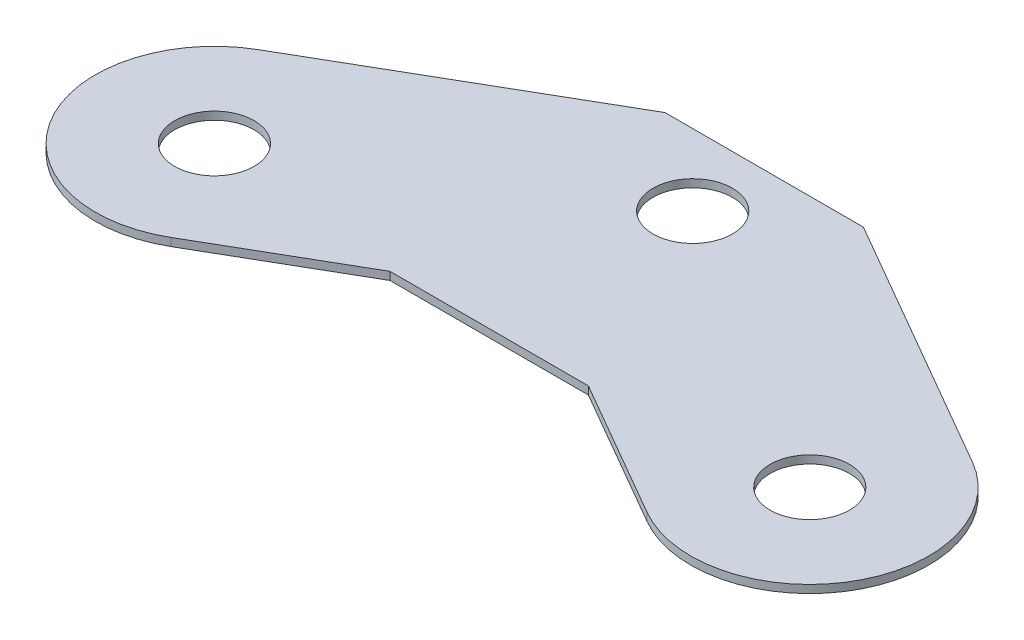
from build123d import *

# Parameters (mm, degrees)
SZKIC1_R                    = 5
DODANIE_WYCI_GNI_CIE1_DEPTH = 1


with BuildPart() as part:
    # Szkic1 → Dodanie-wyciągnięcie1 (new body)
    with BuildSketch(Plane(origin=(0, 0, 0), x_dir=(1, 0, 0), z_dir=(0, 1, 0))):
        with BuildLine():
            Line((-12.5, 34.641016151), (12.5, 34.641016151))
            Line((12.5, 34.641016151), (45, 15.877132403))
            ThreePointArc((45, 15.877132403), (50.490381057, -4.613248654), (30, -10.103629711))
            Line((30, -10.103629711), (12.5, 0))
            Line((12.5, 0), (-12.5, 0))
            Line((-12.5, 0), (-30, -10.103629711))
            ThreePointArc((-30, -10.103629711), (-50.490381057, -4.613248654), (-45, 15.877132403))
            Line((-45, 15.877132403), (-12.5, 34.641016151))
        make_face()
        with Locations(Location((37.5, 2.886751346, 0), (0, 0, 270))):
            Circle(SZKIC1_R, mode=Mode.SUBTRACT)
        with Locations(Location((-37.5, 2.886751346, 0), (0, 0, 90))):
            Circle(SZKIC1_R, mode=Mode.SUBTRACT)
        with Locations(Location((0, 25.641016151, 0), (0, 0, 270))):
            Circle(SZKIC1_R, mode=Mode.SUBTRACT)
    extrude(amount=DODANIE_WYCI_GNI_CIE1_DEPTH)


solid = part.part
